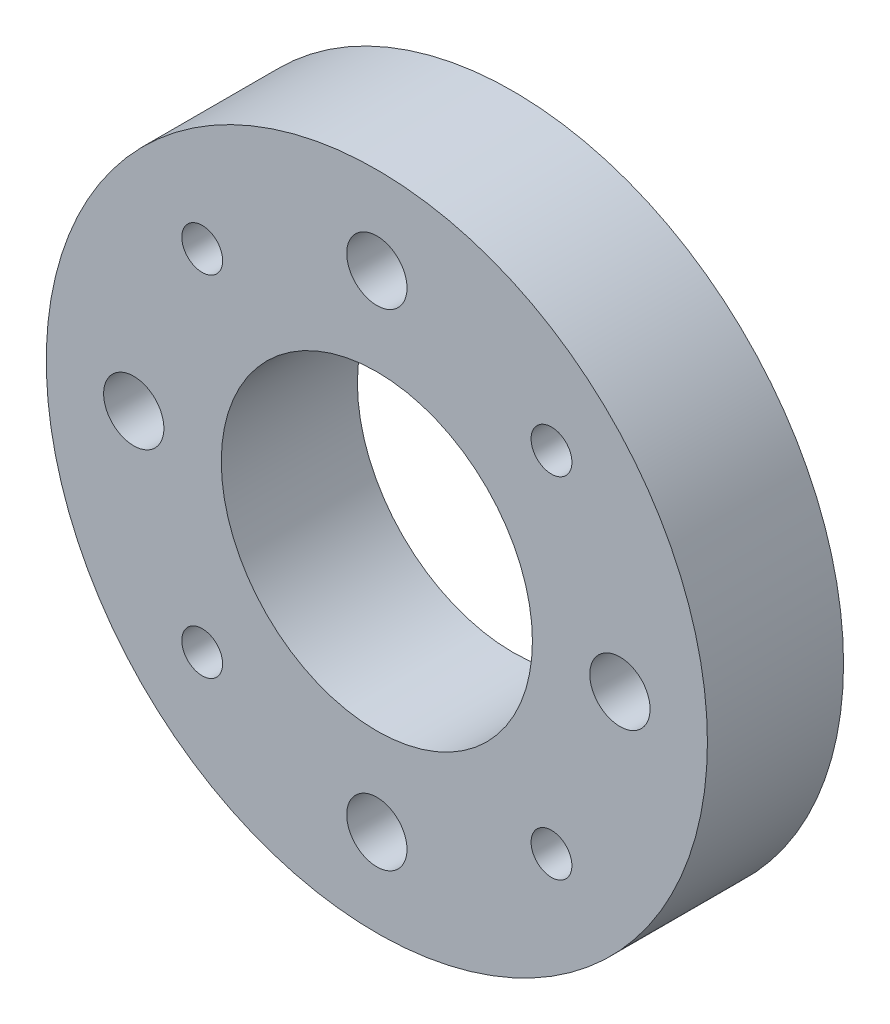
from build123d import *

# Parameters (mm, degrees)
SKETCH1_R           = 17
SKETCH1_R_2         = 1.55
SKETCH1_R_3         = 1.05
SKETCH1_R_4         = 8
BOSS_EXTRUDE1_DEPTH = 7


with BuildPart() as part:
    # Sketch1 → Boss-Extrude1 (new body)
    with BuildSketch(Plane.XY):
        Circle(SKETCH1_R)
        with Locations((0, 12.5)):
            Circle(SKETCH1_R_2, mode=Mode.SUBTRACT)
        with Locations((12.5, 0)):
            Circle(SKETCH1_R_2, mode=Mode.SUBTRACT)
        with Locations((0, -12.5)):
            Circle(SKETCH1_R_2, mode=Mode.SUBTRACT)
        with Locations((-12.5, 0)):
            Circle(SKETCH1_R_2, mode=Mode.SUBTRACT)
        with Locations((-8.980256121, 8.980256121)):
            Circle(SKETCH1_R_3, mode=Mode.SUBTRACT)
        with Locations((8.980256121, 8.980256121)):
            Circle(SKETCH1_R_3, mode=Mode.SUBTRACT)
        with Locations((8.980256121, -8.980256121)):
            Circle(SKETCH1_R_3, mode=Mode.SUBTRACT)
        with Locations((-8.980256121, -8.980256121)):
            Circle(SKETCH1_R_3, mode=Mode.SUBTRACT)
        Circle(SKETCH1_R_4, mode=Mode.SUBTRACT)
    extrude(amount=BOSS_EXTRUDE1_DEPTH)


solid = part.part
